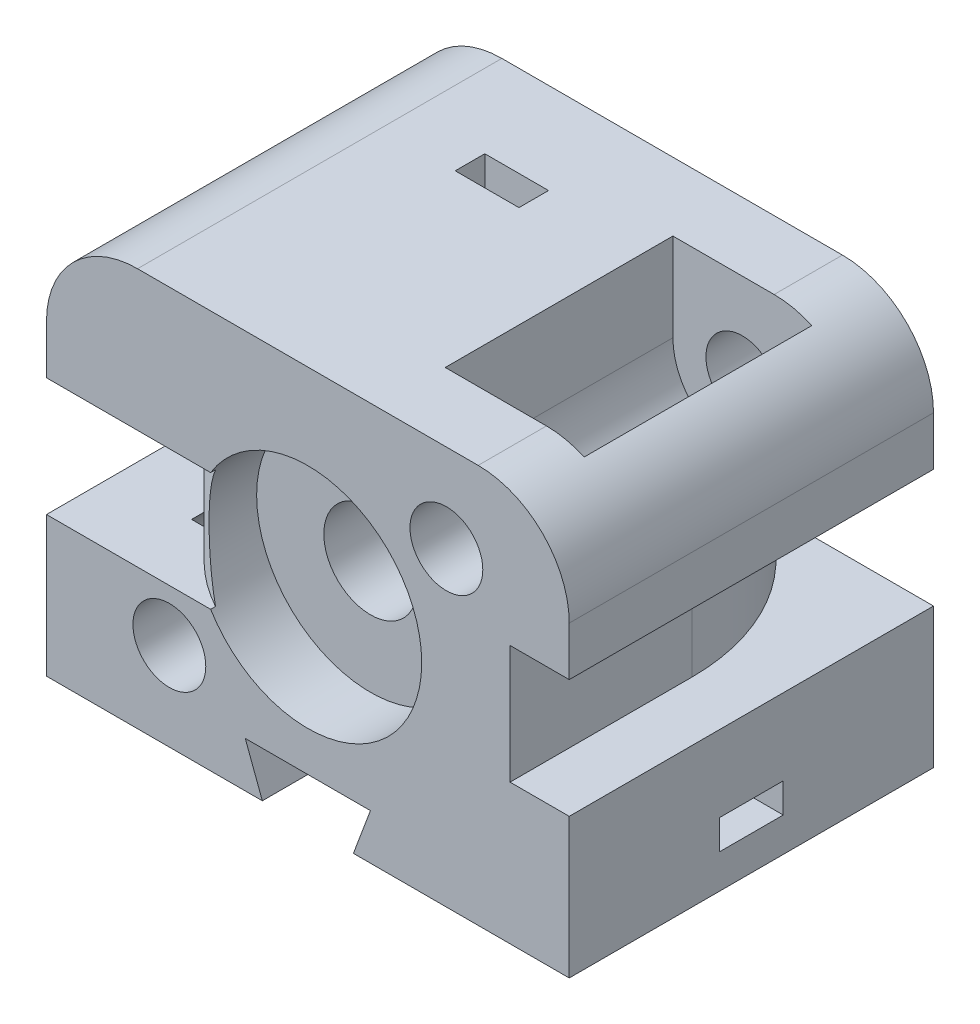
from build123d import *

# Parameters (mm, degrees)
SKETCH1_W                = 45.922011884
SKETCH1_H                = 35
BOSS_EXTRUDE1_DEPTH      = 16
CUT_EXTRUDE1_DEPTH       = 34.006935542
CUT_EXTRUDE1_DEPTH_BACK  = 34.006935542
SKETCH2_R                = 4.1
CUT_EXTRUDE2_REACH       = 45.098
SKETCH4_W                = 5
SKETCH4_H                = 10
CUT_EXTRUDE3_DEPTH       = 10
SKETCH6_R                = 11.2
CUT_EXTRUDE4_DEPTH       = 4
SKETCH7_R                = 5.1
CUT_EXTRUDE5_DEPTH       = 10.5
CIRPATTERN1_COUNT        = 2
CUT_EXTRUDE6_DEPTH       = 34.006935542
CUT_EXTRUDE6_DEPTH_BACK  = 34.006935542
SKETCH8_R                = 3.2
FILLET1_R                = 8
CUT_EXTRUDE8_START       = -4
SKETCH9_R                = 5.1
CUT_EXTRUDE8_DEPTH       = 2.6
CIRPATTERN2_COUNT        = 2
SKETCH13_W               = 32.238994058
SKETCH13_H               = 10.4
CUT_REVOLVE1_ANGLE       = 90
SKETCH14_R               = 10
CUT_EXTRUDE9_DEPTH       = 5.5
CUT_EXTRUDE10_DEPTH      = 44.098234306
CUT_EXTRUDE11_START      = -3
CUT_EXTRUDE11_DEPTH      = 2.6
M3_CLEARANCE_HOLE2_D     = 3.4
M3_CLEARANCE_HOLE2_DEPTH = 10
M3_CLEARANCE_HOLE2_TIP   = 1.021463052


with BuildPart() as part:
    # Sketch1 → Boss-Extrude1 (new, symmetric)
    with BuildSketch(Plane.XY):
        Rectangle(SKETCH1_W, SKETCH1_H)
    extrude(amount=BOSS_EXTRUDE1_DEPTH, both=True)

    # Sketch2 → Cut-Extrude1 (cut, two sides: drawn at the far end of the back side and taken through both)
    with BuildSketch(Plane.XY.offset(-CUT_EXTRUDE1_DEPTH_BACK)):
        Circle(SKETCH2_R)
    extrude(amount=CUT_EXTRUDE1_DEPTH + CUT_EXTRUDE1_DEPTH_BACK, mode=Mode.SUBTRACT)

    # Sketch4 → Cut-Extrude2 (cut, up to next)
    with BuildSketch(Plane.XY.offset(16), mode=Mode.PRIVATE) as cut_extrude2_sk1:
        with Locations((20.461005942, 0)):
            Rectangle(SKETCH4_W, SKETCH4_H)
    cut_extrude2_tool1 = extrude(cut_extrude2_sk1.sketch, amount=-CUT_EXTRUDE2_REACH, mode=Mode.PRIVATE) & part.part
    # Sketch4 → Cut-Extrude2 (cut, up to next)
    with BuildSketch(Plane.XY.offset(16), mode=Mode.PRIVATE) as cut_extrude2_sk2:
        with Locations((-20.461005942, 0)):
            Rectangle(SKETCH4_W, SKETCH4_H)
    cut_extrude2_tool2 = extrude(cut_extrude2_sk2.sketch, amount=-CUT_EXTRUDE2_REACH, mode=Mode.PRIVATE) & part.part
    # Sketch4 → Cut-Extrude2 (cut, up to next)
    with BuildSketch(Plane.XY.offset(16), mode=Mode.PRIVATE) as cut_extrude2_sk3:
        Polygon((17.961005942, 5), (22.961005942, 5), (22.961005942, 5.2), (17.761005942, 5.2), (17.761005942, -5.2), (22.961005942, -5.2), (22.961005942, -5), (17.961005942, -5), align=None)
    cut_extrude2_tool3 = extrude(cut_extrude2_sk3.sketch, amount=-CUT_EXTRUDE2_REACH, mode=Mode.PRIVATE) & part.part
    # Sketch4 → Cut-Extrude2 (cut, up to next)
    with BuildSketch(Plane.XY.offset(16), mode=Mode.PRIVATE) as cut_extrude2_sk4:
        Polygon((-22.961005942, 5.2), (-22.961005942, 5), (-17.961005942, 5), (-17.961005942, -5), (-22.961005942, -5), (-22.961005942, -5.2), (-17.761005942, -5.2), (-17.761005942, 5.2), align=None)
    cut_extrude2_tool4 = extrude(cut_extrude2_sk4.sketch, amount=-CUT_EXTRUDE2_REACH, mode=Mode.PRIVATE) & part.part
    add(cut_extrude2_tool1.solids().sort_by_distance((20.461006, 0, 16))[0], mode=Mode.SUBTRACT)
    add(cut_extrude2_tool2.solids().sort_by_distance((-20.461006, 0, 16))[0], mode=Mode.SUBTRACT)
    add(cut_extrude2_tool3.solids().sort_by_distance((17.84473, 0, 16))[0], mode=Mode.SUBTRACT)
    add(cut_extrude2_tool4.solids().sort_by_distance((-22.84473, 5.1, 16))[0], mode=Mode.SUBTRACT)

    # Sketch5 → Cut-Extrude3 (cut, symmetric)
    # profile 1 of 2: a face of its own
    with BuildSketch(Plane.XY):
        with BuildLine():
            Line((6.067449647, 17.6), (6.067449647, 9.762846361))
            ThreePointArc((6.067449647, 9.762846361), (12.167449647, 3.662846361), (18.267449647, 9.762846361))
            Line((18.267449647, 9.762846361), (18.267449647, 17.6))
            Line((18.267449647, 17.6), (6.067449647, 17.6))
        make_face()
        with BuildLine():
            ThreePointArc((6.167449647, 9.762846361), (12.167449647, 3.762846361), (18.167449647, 9.762846361))
            Line((18.167449647, 9.762846361), (18.167449647, 17.5))
            Line((18.167449647, 17.5), (6.167449647, 17.5))
            Line((6.167449647, 17.5), (6.167449647, 9.762846361))
        make_face(mode=Mode.SUBTRACT)
    # profile 2 of 2: a face of its own
    with BuildSketch(Plane.XY):
        with BuildLine():
            Line((6.167449647, 17.5), (6.167449647, 9.762846361))
            ThreePointArc((6.167449647, 9.762846361), (12.167449647, 3.762846361), (18.167449647, 9.762846361))
            Line((18.167449647, 9.762846361), (18.167449647, 17.5))
            Line((18.167449647, 17.5), (6.167449647, 17.5))
        make_face()
    cut_extrude3 = extrude(amount=CUT_EXTRUDE3_DEPTH, both=True, mode=Mode.SUBTRACT)

    # Sketch6 → Cut-Extrude4 (cut)
    with BuildSketch(Plane(origin=(0, 0, -16), x_dir=(-1, 0, 0), z_dir=(0, 0, -1))):
        Circle(SKETCH6_R)
    extrude(amount=-CUT_EXTRUDE4_DEPTH, mode=Mode.SUBTRACT)

    # Sketch7 → Cut-Extrude5 (cut)
    with BuildSketch(Plane(origin=(0, 0, -12), x_dir=(-1, 0, 0), z_dir=(0, 0, -1))):
        Circle(SKETCH7_R)
    extrude(amount=-CUT_EXTRUDE5_DEPTH, mode=Mode.SUBTRACT)

    # CirPattern1: Cut-Extrude3 ×2 about axis
    cirpattern1_axis = Axis((0, 0, 0), (0, 0, 1))
    for i in range(1, CIRPATTERN1_COUNT):
        add(cut_extrude3.rotate(cirpattern1_axis, i * 360 / CIRPATTERN1_COUNT), mode=Mode.SUBTRACT)

    # Sketch8 → Cut-Extrude6 (cut, two sides: drawn at the far end of the back side and taken through both)
    with BuildSketch(Plane.XY.offset(-CUT_EXTRUDE6_DEPTH_BACK)):
        with Locations((-12.167449647, -9.762846361)):
            Circle(SKETCH8_R)
        with Locations((12.167449647, 9.762846361)):
            Circle(SKETCH8_R)
    extrude(amount=CUT_EXTRUDE6_DEPTH + CUT_EXTRUDE6_DEPTH_BACK, mode=Mode.SUBTRACT)

    # Fillet1
    # the kernel refuses this fillet: 8 mm, written as the material it takes off along each edge
    with BuildSketch(Plane(origin=(22.961005942, 17.5, -36), x_dir=(-1, 0, 0), z_dir=(0, 0, 1))) as fillet1_piece_1:
        with BuildLine():
            CenterArc((FILLET1_R, FILLET1_R), FILLET1_R, 180, 90)
            Line((0, FILLET1_R), (0, 0))
            Line((0, 0), (FILLET1_R, 0))
        make_face()
    extrude(amount=72, mode=Mode.SUBTRACT)
    with BuildSketch(Plane(origin=(-22.961005942, 17.5, 36), x_dir=(0, -1, 0), z_dir=(0, 0, -1))) as fillet1_piece_2:
        with BuildLine():
            CenterArc((FILLET1_R, -FILLET1_R), FILLET1_R, 90, 90)
            Line((0, -FILLET1_R), (0, 0))
            Line((0, 0), (FILLET1_R, 0))
        make_face()
    extrude(amount=72, mode=Mode.SUBTRACT)

    # Sketch9 → Cut-Extrude8 (cut)
    with BuildSketch(Plane(origin=(0, 0, -12), x_dir=(-1, 0, 0), z_dir=(0, 0, -1)).offset(CUT_EXTRUDE8_START)):
        with BuildLine():
            Line((2.856854249, 17.5), (2.856854249, 10.829514477))
            ThreePointArc((2.856854249, 10.829514477), (5.919350665, 9.507959177), (8.456854249, 7.34313395))
            Line((8.456854249, 7.34313395), (8.456854249, 17.5))
            Line((8.456854249, 17.5), (2.856854249, 17.5))
        make_face()
        Circle(SKETCH9_R)
        Polygon((2.856854249, 4.040273496), (5.656854249, 2.423692742), (8.456854249, 4.040273496), (8.456854249, 7.273435003), (5.656854249, 8.890015757), (2.856854249, 7.273435003), align=None)
        with BuildLine():
            Line((2.856854249, 10.829514477), (2.856854249, 7.273435003))
            Line((2.856854249, 7.273435003), (5.656854249, 8.890015757))
            Line((5.656854249, 8.890015757), (8.456854249, 7.273435003))
            Line((8.456854249, 7.273435003), (8.456854249, 7.34313395))
            ThreePointArc((8.456854249, 7.34313395), (5.919350665, 9.507959177), (2.856854249, 10.829514477))
        make_face()
    cut_extrude8 = extrude(amount=-CUT_EXTRUDE8_DEPTH, mode=Mode.SUBTRACT)

    # Sketch11 → M3 Clearance Hole1 (revolve, cut)
    with BuildSketch(Plane(origin=(-5.656854249, 5.656854249, -12), x_dir=(0, 1, 0), z_dir=(1, 0, 0))):
        Polygon((0, 0), (0, 11.021463052), (1.7, 10), (1.7, 0), align=None)
    m3_clearance_hole1 = revolve(axis=Axis((-5.656854249, 5.656854249, -18.35), (0, 0, 1)), mode=Mode.SUBTRACT)

    # CirPattern2: Cut-Extrude8, M3 Clearance Hole1 ×2 about axis
    cirpattern2_axis = Axis((0, 0, 0), (0, 0, 1))
    add([cut_extrude8.rotate(cirpattern2_axis, i * 360 / CIRPATTERN2_COUNT) for i in range(1, CIRPATTERN2_COUNT)], mode=Mode.SUBTRACT)
    add([m3_clearance_hole1.rotate(cirpattern2_axis, i * 360 / CIRPATTERN2_COUNT) for i in range(1, CIRPATTERN2_COUNT)], mode=Mode.SUBTRACT)

    # Sketch13 → Cut-Revolve1 (revolve, cut)
    with BuildSketch(Plane.XY):
        with Locations((33.880502971, 0)):
            Rectangle(SKETCH13_W, SKETCH13_H)
        with Locations((-33.880502971, 0)):
            Rectangle(SKETCH13_W, SKETCH13_H)
    revolve(axis=Axis((0, 0, 0), (0, 1, 0)), revolution_arc=CUT_REVOLVE1_ANGLE, mode=Mode.SUBTRACT)

    # Sketch14 → Cut-Extrude9 (cut)
    with BuildSketch(Plane.XY.offset(16)):
        Circle(SKETCH14_R)
    extrude(amount=-CUT_EXTRUDE9_DEPTH, mode=Mode.SUBTRACT)

    # Sketch15 → Cut-Extrude10 (cut, through all)
    with BuildSketch(Plane.XY.offset(16)):
        Polygon((-4, -17.5), (-5.5, -13.5), (5.5, -13.5), (4, -17.5), align=None)
    extrude(amount=-CUT_EXTRUDE10_DEPTH, mode=Mode.SUBTRACT)

    # Sketch16 → Cut-Extrude11 (cut)
    with BuildSketch(Plane.XZ.offset(17.5).offset(CUT_EXTRUDE11_START)):
        Polygon((19.616580754, -2.8), (21.233161507, 0), (19.616580754, 2.8), (16.383419246, 2.8), (14.766838493, 0), (16.383419246, -2.8), align=None)
        Polygon((21.233161507, 0), (19.616580754, -2.8), (22.961005942, -2.8), (22.961005942, 2.8), (19.616580754, 2.8), align=None)
    extrude(amount=-CUT_EXTRUDE11_DEPTH, mode=Mode.SUBTRACT)

    # M3 Clearance Hole2
    with Locations(Plane(origin=(0, -17.5, 0), x_dir=(-1, 0, 0), z_dir=(0, -1, 0))):
        with Locations((-18, 0)):
            Hole(M3_CLEARANCE_HOLE2_D / 2, depth=M3_CLEARANCE_HOLE2_DEPTH)
            with Locations((0, 0, -(M3_CLEARANCE_HOLE2_DEPTH + M3_CLEARANCE_HOLE2_TIP / 2))):  # 118° drill point
                Cone(0, M3_CLEARANCE_HOLE2_D / 2, M3_CLEARANCE_HOLE2_TIP, mode=Mode.SUBTRACT)


solid = part.part
